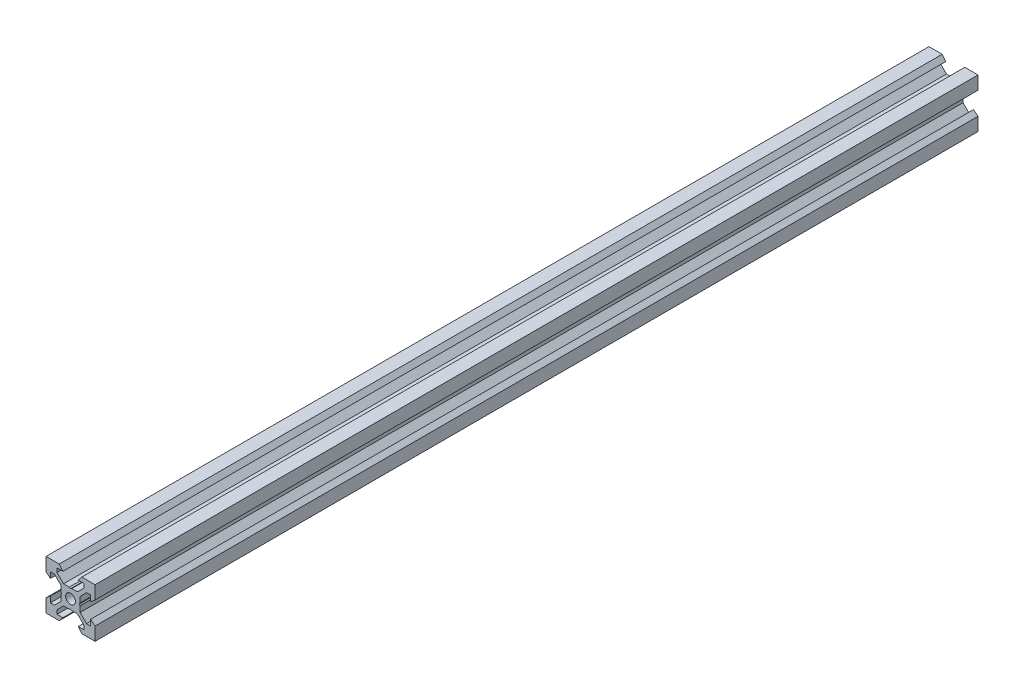
from build123d import *

# Parameters (mm, degrees)
SKETCH1_R           = 2
BOSS_EXTRUDE1_DEPTH = 180


with BuildPart() as part:
    # Sketch1 → Boss-Extrude1 (new, symmetric)
    with BuildSketch(Plane.XY):
        Polygon((10, 4.610379336), (10, 10), (4.610379336, 10), (3.1, 8.2), (5.5, 8.2), (5.5, 6.560660172), (2.839339828, 3.9), (0.519615242, 3.9), (0, 3.6), (-0.519615242, 3.9), (-2.839339828, 3.9), (-5.5, 6.560660172), (-5.5, 8.2), (-3.1, 8.2), (-4.610379336, 10), (-10, 10), (-10, 4.610379336), (-8.2, 3.1), (-8.2, 5.5), (-6.560660172, 5.5), (-3.9, 2.839339828), (-3.9, 0.519615242), (-3.6, 0), (-3.9, -0.519615242), (-3.9, -2.839339828), (-6.560660172, -5.5), (-8.2, -5.5), (-8.2, -3.1), (-10, -4.610379336), (-10, -10), (-4.610379336, -10), (-3.1, -8.2), (-5.5, -8.2), (-5.5, -6.560660172), (-2.839339828, -3.9), (-0.519615242, -3.9), (0, -3.6), (0.519615242, -3.9), (2.839339828, -3.9), (5.5, -6.560660172), (5.5, -8.2), (3.1, -8.2), (4.610379336, -10), (10, -10), (10, -4.610379336), (8.2, -3.1), (8.2, -5.5), (6.560660172, -5.5), (3.9, -2.839339828), (3.9, -0.519615242), (3.6, 0), (3.9, 0.519615242), (3.9, 2.839339828), (6.560660172, 5.5), (8.2, 5.5), (8.2, 3.1), align=None)
        Circle(SKETCH1_R, mode=Mode.SUBTRACT)
    extrude(amount=BOSS_EXTRUDE1_DEPTH, both=True)


solid = part.part
